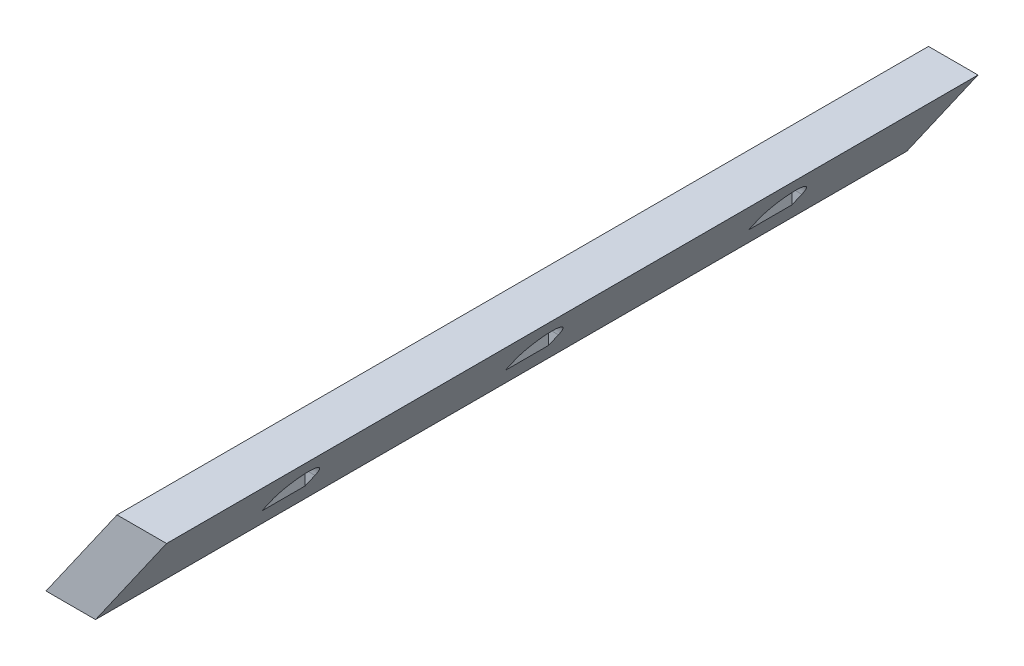
from build123d import *

# Parameters (mm, degrees)
BOSS_EXTRUDE1_DEPTH = 127
CUT_EXTRUDE2_DEPTH  = 7.112


with BuildPart() as part:
    # end-profile → Boss-Extrude1 (new body)
    with BuildSketch(Plane.XY):
        Polygon((0, 0), (7.751918639, 0), (18.867713308, 15.875), (11.115794669, 15.875), align=None)
    extrude(amount=BOSS_EXTRUDE1_DEPTH)

    # Sketch5 → Cut-Extrude2 (cut)
    with BuildSketch(Plane(origin=(18.867713308, 0, 0), x_dir=(0, 0, -1), z_dir=(1, 0, 0))):
        with BuildLine():
            Line((-104.98709, 7.9375), (-104.98709, 0))
            Line((-104.98709, 0), (-98.21291, 0))
            Line((-98.21291, 0), (-98.21291, 7.9375))
            ThreePointArc((-98.21291, 7.9375), (-101.6, 11.32459), (-104.98709, 7.9375))
        make_face()
        with BuildLine():
            Line((-66.88709, 7.9375), (-66.88709, 0))
            Line((-66.88709, 0), (-60.11291, 0))
            Line((-60.11291, 0), (-60.11291, 7.9375))
            ThreePointArc((-60.11291, 7.9375), (-63.5, 11.32459), (-66.88709, 7.9375))
        make_face()
        with BuildLine():
            Line((-28.78709, 7.9375), (-28.78709, 0))
            Line((-28.78709, 0), (-22.01291, 0))
            Line((-22.01291, 0), (-22.01291, 7.9375))
            ThreePointArc((-22.01291, 7.9375), (-25.4, 11.32459), (-28.78709, 7.9375))
        make_face()
    extrude(amount=-CUT_EXTRUDE2_DEPTH, mode=Mode.SUBTRACT)


solid = part.part
